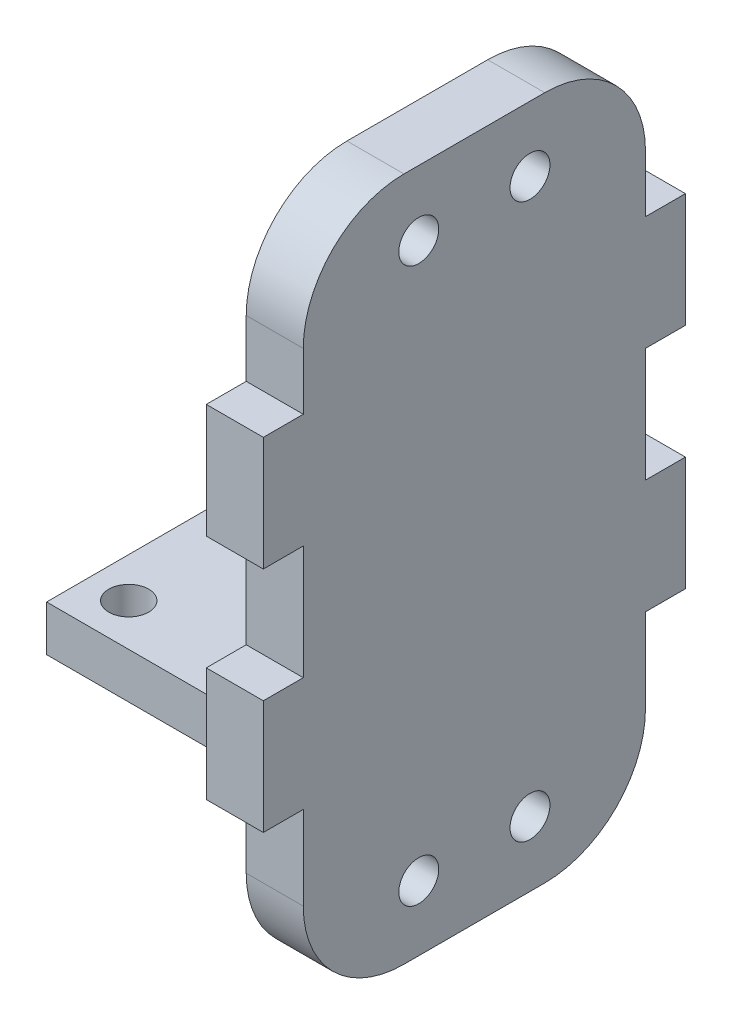
from build123d import *

# Parameters (mm, degrees)
BOSS_EXTRUDE1_START     = -5
BOSS_EXTRUDE1_OUTLINE_R = 1.75
BOSS_EXTRUDE1_DEPTH     = 5
SKETCH3_W               = 25
SKETCH3_H               = 4
BOSS_EXTRUDE2_DEPTH     = 20
SKETCH4_R               = 1.75
CUT_EXTRUDE1_DEPTH      = 4
BOSS_EXTRUDE3_DEPTH     = 25
FILLET2_R               = 2


with BuildPart() as part:
    # Boss-Extrude1: read off the stored shape, not the designer's step
    # Boss-Extrude1 outline → Boss-Extrude1 (new body)
    with BuildSketch(Plane(origin=(5, 0, 0), x_dir=(0, 0, -1), z_dir=(1, 0, 0)).offset(BOSS_EXTRUDE1_START)):
        with BuildLine():
            Line((-6.17, -30), (6.17, -30))
            ThreePointArc((6.17, -30), (12.413752878, -27.413752878), (15, -21.17))
            Line((15, -21.17), (15, -13.83))
            Line((15, -13.83), (18.5, -13.83))
            Line((18.5, -13.83), (18.5, -3.83))
            Line((18.5, -3.83), (15, -3.83))
            Line((15, -3.83), (15, 6.17))
            Line((15, 6.17), (18.5, 6.17))
            Line((18.5, 6.17), (18.5, 16.17))
            Line((18.5, 16.17), (15, 16.17))
            Line((15, 16.17), (15, 21.17))
            ThreePointArc((15, 21.17), (12.413752878, 27.413752878), (6.17, 30))
            Line((6.17, 30), (-6.17, 30))
            ThreePointArc((-6.17, 30), (-12.413752878, 27.413752878), (-15, 21.17))
            Line((-15, 21.17), (-15, 16.17))
            Line((-15, 16.17), (-18.5, 16.17))
            Line((-18.5, 16.17), (-18.5, 6.17))
            Line((-18.5, 6.17), (-15, 6.17))
            Line((-15, 6.17), (-15, -3.83))
            Line((-15, -3.83), (-18.5, -3.83))
            Line((-18.5, -3.83), (-18.5, -13.83))
            Line((-18.5, -13.83), (-15, -13.83))
            Line((-15, -13.83), (-15, -21.17))
            ThreePointArc((-15, -21.17), (-12.413752878, -27.413752878), (-6.17, -30))
        make_face()
        with Locations((-4.875, -24.3)):
            Circle(BOSS_EXTRUDE1_OUTLINE_R, mode=Mode.SUBTRACT)
        with Locations((4.875, -24.3)):
            Circle(BOSS_EXTRUDE1_OUTLINE_R, mode=Mode.SUBTRACT)
        with Locations((-4.875, 24.3)):
            Circle(BOSS_EXTRUDE1_OUTLINE_R, mode=Mode.SUBTRACT)
        with Locations((4.875, 24.3)):
            Circle(BOSS_EXTRUDE1_OUTLINE_R, mode=Mode.SUBTRACT)
    extrude(amount=BOSS_EXTRUDE1_DEPTH)

    # Sketch3 → Boss-Extrude2 (add)
    with BuildSketch(Plane.ZY):
        with Locations((0, -13.83)):
            Rectangle(SKETCH3_W, SKETCH3_H)
    extrude(amount=BOSS_EXTRUDE2_DEPTH)

    # Sketch4 → Cut-Extrude1 (cut)
    with BuildSketch(Plane.XZ.offset(15.83)):
        with Locations(Location((-16.5, -8.8, 0), (0, 0, 270))):
            Circle(SKETCH4_R)
        with Locations(Location((-16.5, 8.8, 0), (0, 0, 90))):
            Circle(SKETCH4_R)
    extrude(amount=-CUT_EXTRUDE1_DEPTH, mode=Mode.SUBTRACT)

    # Sketch6 → Boss-Extrude3 (add)
    with BuildSketch(Plane.XY.offset(12.5)):
        Polygon((0, -11.83), (1.101299034, -11.83), (1.101299034, -6.83), (0, -6.83), (-5.038932071, -11.83), align=None)
        Polygon((-5.038932071, -15.83), (0, -15.83), (1.101299034, -15.83), (1.101299034, -20.83), (0, -20.83), align=None)
    extrude(amount=-BOSS_EXTRUDE3_DEPTH)

    # Fillet2
    fillet2_edges = [part.edges().sort_by_distance(p)[0] for p in [
        (0, -6.83, 0),
        (-5.038932071, -11.83, 0),
        (-5.038932071, -15.83, 0),
        (0, -20.83, 0),
    ]]
    fillet(fillet2_edges, radius=FILLET2_R)


solid = part.part
